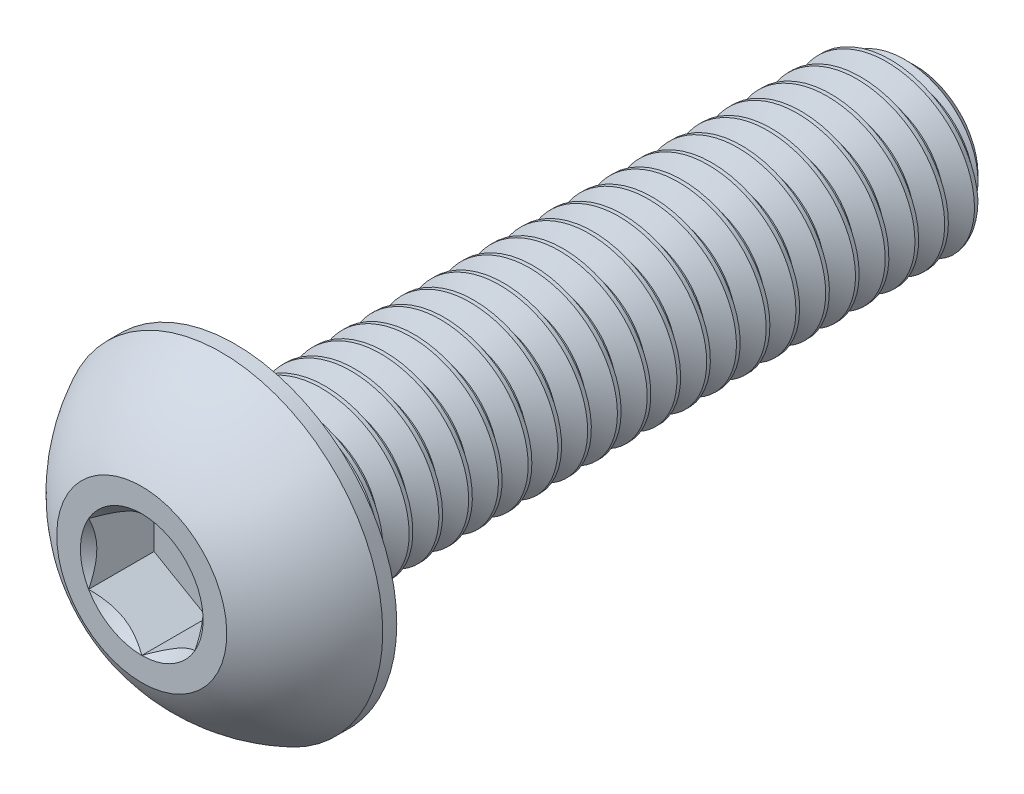
from build123d import *

# Parameters (mm, degrees)
CUT_EXTRUDE2_DEPTH = 1.54
CUT_SWEEP2_PITCH   = 0.7
CUT_SWEEP2_TO      = 16


with BuildPart() as part:
    # Sketch10 → Revolve3 (revolve)
    with BuildSketch(Plane(origin=(0, 0, 0), x_dir=(0, 0, -1), z_dir=(1, 0, 0)), mode=Mode.PRIVATE) as revolve3_sk:
        Polygon((17.675, 2), (18.2, 1.475), (18.2, 0), (2.2, 0), (2.2, 2), align=None)
    revolve(revolve3_sk.sketch.rotate(Axis((0, 0, 0), (0, 0, -1)), 90), axis=Axis((0, 0, 0), (0, 0, -1)))

    # Sketch7 → Revolve2 (revolve)
    with BuildSketch(Plane(origin=(0, 0, 0), x_dir=(0, 0, -1), z_dir=(1, 0, 0)), mode=Mode.PRIVATE) as revolve2_sk:
        with BuildLine():
            Line((1.87, 3.8), (2.2, 3.8))
            Line((2.2, 3.8), (2.2, 0))
            Line((2.2, 0), (0, 0))
            Line((0, 0), (0, 2))
            ThreePointArc((0, 2), (0.793500147, 3.047002626), (1.87, 3.8))
        make_face()
    revolve(revolve2_sk.sketch.rotate(Axis((0, 0, 0), (0, 0, -1)), 180), axis=Axis((0, 0, 0), (0, 0, -1)))

    # Sketch5 → Cut-Extrude2 (cut)
    with BuildSketch(Plane.XY):
        Polygon((1.25, -0.721687836), (1.25, 0.721687836), (0, 1.443375673), (-1.25, 0.721687836), (-1.25, -0.721687836), (0, -1.443375673), align=None)
    extrude(amount=-CUT_EXTRUDE2_DEPTH, mode=Mode.SUBTRACT)

    # Cut-Extrude3 cone 1 section (through the dimple's axis) → Cut-Extrude3 (revolve, cut)
    with BuildSketch(Plane(origin=(0, 0, 0), x_dir=(0, -1, 0), z_dir=(1, 0, 0))):
        Polygon((0, 0), (1.443375673, 0), (0, 1.443375673), align=None)
    revolve(axis=Axis((0, 0, 0), (0, 0, -1)), mode=Mode.SUBTRACT)


with BuildPart() as body_2:
    # Split1: read off the stored shape, not the designer's step
    # Split1: the piece on the far side of the plane
    add(part.part)
    split(bisect_by=Plane.XY.offset(-2.2), keep=Keep.BOTTOM)

    # Cut-Sweep2: arcs per turn and ends read off the stored shape
    # Cut-Sweep2: the profile of Sketch12 screwed along a right-hand helix through 27 turns, 6 arcs to a turn; built about Z, then put on its axis
    cut_sweep2_z = Axis((0, 0, 0), (0, 0, 1))
    cut_sweep2_corners = [(1.545336663, 0, -0.2625), (1.545336663, 0, -0.35), (2.037888611, 0, -0.634375), (2.037888611, 0, 0.021875)]
    with BuildLine(mode=Mode.PRIVATE) as cut_sweep2_profile:
        Line(cut_sweep2_corners[0], cut_sweep2_corners[1])
        Line(cut_sweep2_corners[1], cut_sweep2_corners[2])
        Line(cut_sweep2_corners[2], cut_sweep2_corners[3])
        Line(cut_sweep2_corners[3], cut_sweep2_corners[0])
    cut_sweep2_cap = Face(cut_sweep2_profile.wire())
    cut_sweep2_turn_angles = [0, 30, 60, 90, 120, 150, 180, 210, 240, 270, 300, 330, 360]
    cut_sweep2_turn_weights = [1, 0.8660254037844387, 1, 0.8660254037844387, 1, 0.8660254037844387, 1, 0.8660254037844387, 1, 0.8660254037844387, 1, 0.8660254037844387, 1]
    cut_sweep2_turn_rails = [Edge.make_bspline([Vector(p[0], p[1], 0).rotate(cut_sweep2_z, cut_sweep2_turn_angles[k]) / cut_sweep2_turn_weights[k] + Vector(0, 0, p[2] + CUT_SWEEP2_PITCH * cut_sweep2_turn_angles[k] / 360) for k in range(13)], [0, 0, 0, 1, 1, 2, 2, 3, 3, 4, 4, 5, 5, 6, 6, 6], 2, cut_sweep2_turn_weights) for p in cut_sweep2_corners]
    cut_sweep2_turn_sides = [Face.make_surface_from_curves(cut_sweep2_turn_rails[p[0]], cut_sweep2_turn_rails[p[1]]) for p in [(0, 1), (1, 2), (2, 3), (3, 0)]]
    cut_sweep2 = Plane(origin=(0, 0, -18.2), x_dir=(0, 1, 0), z_dir=(0, 0, 1)) * split(Solid(Shell([*[p.moved(Location((0, 0, CUT_SWEEP2_PITCH * i))) for i in range(27) for p in cut_sweep2_turn_sides], cut_sweep2_cap, cut_sweep2_cap.rotate(cut_sweep2_z, 9720).moved(Location((0, 0, CUT_SWEEP2_PITCH * 9720 / 360)))])), bisect_by=Plane.XY.offset(CUT_SWEEP2_TO), keep=Keep.BOTTOM, mode=Mode.PRIVATE)
    add(cut_sweep2, mode=Mode.SUBTRACT)


with BuildPart() as part_1:
    add(part.part)

    # Split1
    split(bisect_by=Plane.XY.offset(-2.2), keep=Keep.TOP)

    add(body_2.part)  # Boss-Extrude1 merges body 2
    # Boss-Extrude1 cone 1 section (through the dimple's axis) → Boss-Extrude1 (revolve)
    with BuildSketch(Plane(origin=(0, 0, -2.2), x_dir=(0, -1, 0), z_dir=(1, 0, 0))):
        Polygon((0, 0), (2, 0), (0, 2), align=None)
    revolve(axis=Axis((0, 0, -2.2), (0, 0, -1)))


solid = part_1.part
